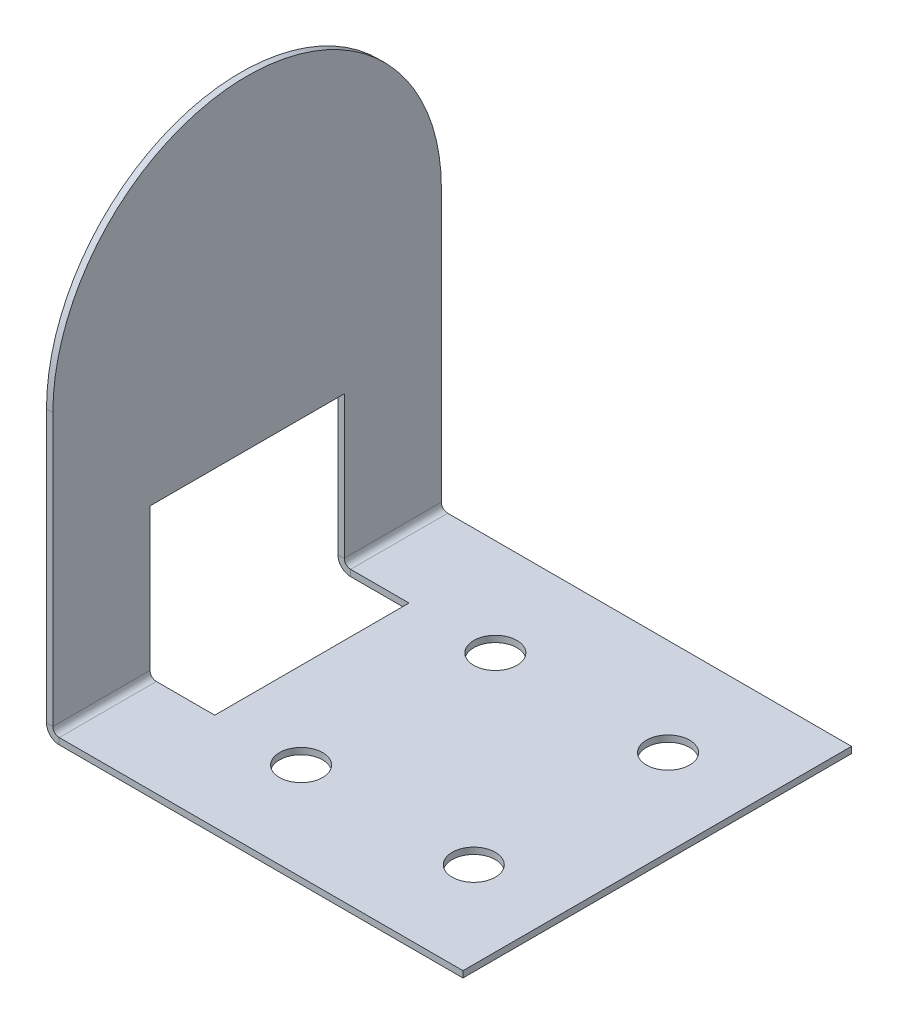
from build123d import *

# Parameters (mm, degrees)
SKETCH1_R                  = 2.5
SKETCH1_W                  = 25
SKETCH1_H                  = 22.5
BASE_FLANGE3_DEPTH         = 0.7366
SKETCHED_START             = -22.5
SKETCHED_BEND1_DEPTH       = 45
SKETCHED_BEND1_2_DEPTH     = 11.25
SKETCHED_START_2           = 11.25
SKETCHED_BEND1_3_DEPTH     = 11.25
SKETCHED_START_3           = -63
SKETCHED_BEND1_4_OUTLINE_W = 0.7366
SKETCHED_BEND1_4_OUTLINE_H = 45
SKETCHED_BEND1_4_DEPTH     = 38
SKETCHED_START_4           = -8.2366
SKETCHED_BEND1_5_DEPTH     = 0.7366


with BuildPart() as part:
    # Base-Flange3: sheet metal written as solids
    # Sketch1 → Base-Flange3 (new body)
    with BuildSketch(Plane(origin=(0, 0, 0), x_dir=(1, 0, 0), z_dir=(0, 1, 0))):
        with BuildLine():
            Line((-40, 22.5), (40, 22.5))
            Line((40, 22.5), (40, -22.5))
            Line((40, -22.5), (-40, -22.5))
            ThreePointArc((-40, -22.5), (-62.5, 0), (-40, 22.5))
        make_face()
        with Locations(Location((10, -11.25, 0), (0, 0, 270))):
            Circle(SKETCH1_R, mode=Mode.SUBTRACT)
        with Locations(Location((10, 11.25, 0), (0, 0, 270))):
            Circle(SKETCH1_R, mode=Mode.SUBTRACT)
        with Locations(Location((30, -11.25, 0), (0, 0, 270))):
            Circle(SKETCH1_R, mode=Mode.SUBTRACT)
        with Locations(Location((30, 11.25, 0), (0, 0, 270))):
            Circle(SKETCH1_R, mode=Mode.SUBTRACT)
        with Locations((-12.5, 0)):
            Rectangle(SKETCH1_W, SKETCH1_H, mode=Mode.SUBTRACT)
    extrude(amount=-BASE_FLANGE3_DEPTH)

    # Sketched Bend1: read off the stored shape, not the designer's step
    # Sketched Bend1 outline → Sketched Bend1 (cut)
    with BuildSketch(Plane.XY.offset(SKETCHED_START)):
        with BuildLine():
            ThreePointArc((-6.7634, -0.7366), (-7.5, -0.539228625), (-8.039228625, 0))
            Line((-8.039228625, 0), (-25, 0))
            Line((-25, 0), (-25, -0.7366))
            Line((-25, -0.7366), (-6.7634, -0.7366))
        make_face()
    extrude(amount=SKETCHED_BEND1_DEPTH, mode=Mode.SUBTRACT)

    # Sketched Bend1 2 outline → Sketched Bend1 2 (add)
    with BuildSketch(Plane.XY.offset(SKETCHED_START)):
        with BuildLine():
            Line((-7.5, 17.237627139), (-8.2366, 17.237627139))
            Line((-8.2366, 17.237627139), (-8.2366, 0.7366))
            ThreePointArc((-8.2366, 0.7366), (-8.186401927, 0.355307783), (-8.039228625, 0))
            Line((-8.039228625, 0), (-6.7634, 0))
            ThreePointArc((-6.7634, 0), (-7.284254855, 0.215745145), (-7.5, 0.7366))
            Line((-7.5, 0.7366), (-7.5, 17.237627139))
        make_face()
    extrude(amount=SKETCHED_BEND1_2_DEPTH)

    # Sketched Bend1 3 outline → Sketched Bend1 3 (add)
    with BuildSketch(Plane.XY.offset(SKETCHED_START_2)):
        with BuildLine():
            Line((-7.5, 17.237627139), (-8.2366, 17.237627139))
            Line((-8.2366, 17.237627139), (-8.2366, 0.7366))
            ThreePointArc((-8.2366, 0.7366), (-8.186401927, 0.355307783), (-8.039228625, 0))
            Line((-8.039228625, 0), (-6.7634, 0))
            ThreePointArc((-6.7634, 0), (-7.284254855, 0.215745145), (-7.5, 0.7366))
            Line((-7.5, 0.7366), (-7.5, 17.237627139))
        make_face()
    extrude(amount=SKETCHED_BEND1_3_DEPTH)

    # Sketched Bend1 4 outline → Sketched Bend1 4 (cut)
    with BuildSketch(Plane.YZ.offset(SKETCHED_START_3)):
        with Locations((-0.3683, 0)):
            Rectangle(SKETCHED_BEND1_4_OUTLINE_W, SKETCHED_BEND1_4_OUTLINE_H)
    extrude(amount=SKETCHED_BEND1_4_DEPTH, mode=Mode.SUBTRACT)

    # Sketched Bend1 5 outline → Sketched Bend1 5 (add)
    with BuildSketch(Plane.YZ.offset(SKETCHED_START_4)):
        with BuildLine():
            ThreePointArc((32.237627139, -22.5), (54.737627139, 0), (32.237627139, 22.5))
            Line((32.237627139, 22.5), (17.237627139, 22.5))
            Line((17.237627139, 22.5), (17.237627139, -22.5))
            Line((17.237627139, -22.5), (32.237627139, -22.5))
        make_face()
    extrude(amount=SKETCHED_BEND1_5_DEPTH)


solid = part.part
